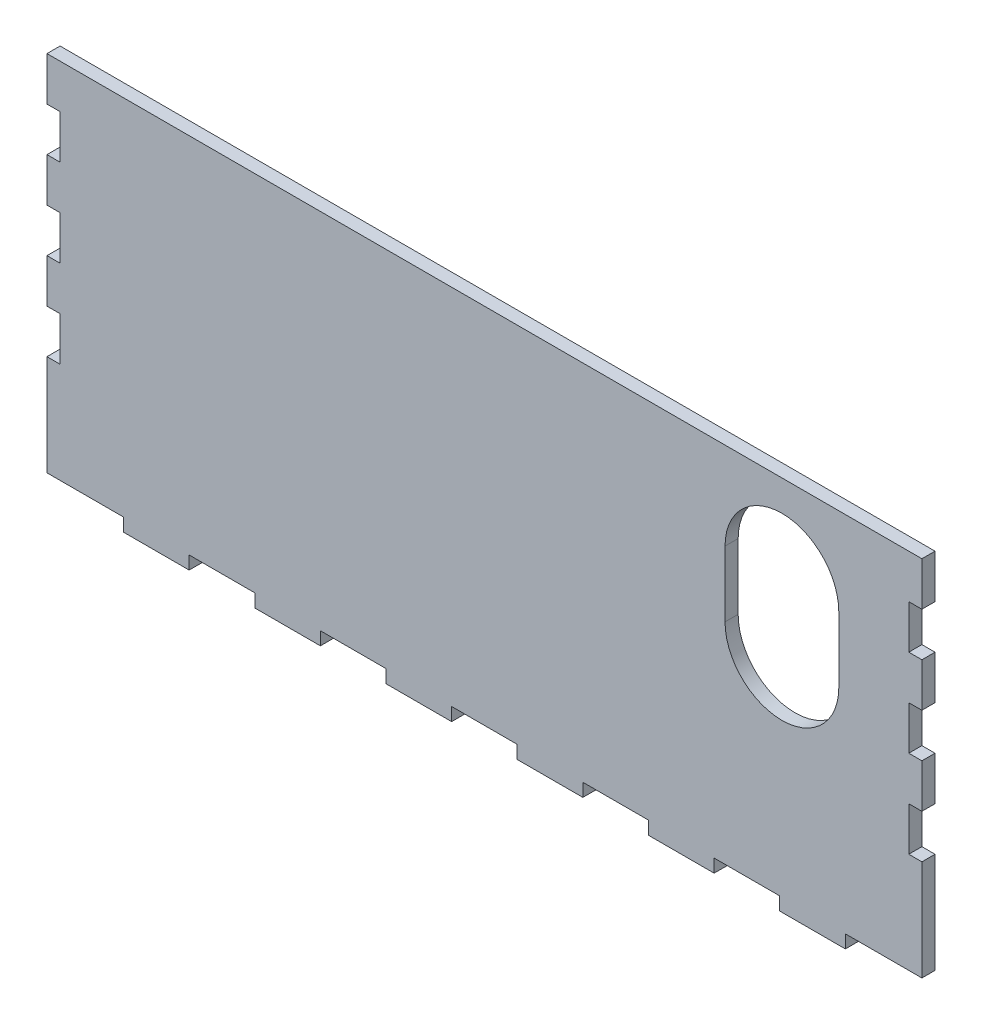
from build123d import *

# Parameters (mm, degrees)
BOSS_EXTRUDE1_DEPTH = 3
CUT_EXTRUDE1_DEPTH  = 10


with BuildPart() as part:
    # Sketch1 → Boss-Extrude1 (new body)
    with BuildSketch(Plane.XY):
        Polygon((100, -2.5), (97, -2.5), (97, 7.5), (100, 7.5), (100, 17.5), (97, 17.5), (97, 27.5), (100, 27.5), (100, 37.5), (97, 37.5), (97, 47.5), (100, 47.5), (100, 57.5), (97, 57.5), (-97, 57.5), (-100, 57.5), (-100, 47.5), (-97, 47.5), (-97, 37.5), (-100, 37.5), (-100, 27.5), (-97, 27.5), (-97, 17.5), (-100, 17.5), (-100, 7.5), (-97, 7.5), (-97, -2.5), (-100, -2.5), (-100, -25.5), (-97, -25.5), (-82.5, -25.5), (-82.5, -28.5), (-67.5, -28.5), (-67.5, -25.5), (-52.5, -25.5), (-52.5, -28.5), (-37.5, -28.5), (-37.5, -25.5), (-22.5, -25.5), (-22.5, -28.5), (-7.5, -28.5), (-7.5, -25.5), (0, -25.5), (7.5, -25.5), (7.5, -28.5), (22.5, -28.5), (22.5, -25.5), (30, -25.5), (37.5, -25.5), (37.5, -28.5), (52.5, -28.5), (52.5, -25.5), (60, -25.5), (67.5, -25.5), (67.5, -28.5), (82.5, -28.5), (82.5, -25.5), (97, -25.5), (100, -25.5), align=None)
    extrude(amount=BOSS_EXTRUDE1_DEPTH)

    # Sketch2 → Cut-Extrude1 (cut)
    with BuildSketch(Plane.XY.offset(3)):
        with BuildLine():
            Line((55, 22.5), (55, 37.5))
            ThreePointArc((55, 37.5), (68, 50.5), (81, 37.5))
            Line((81, 37.5), (81, 22.5))
            ThreePointArc((81, 22.5), (68, 9.5), (55, 22.5))
        make_face()
    extrude(amount=-CUT_EXTRUDE1_DEPTH, mode=Mode.SUBTRACT)


solid = part.part
